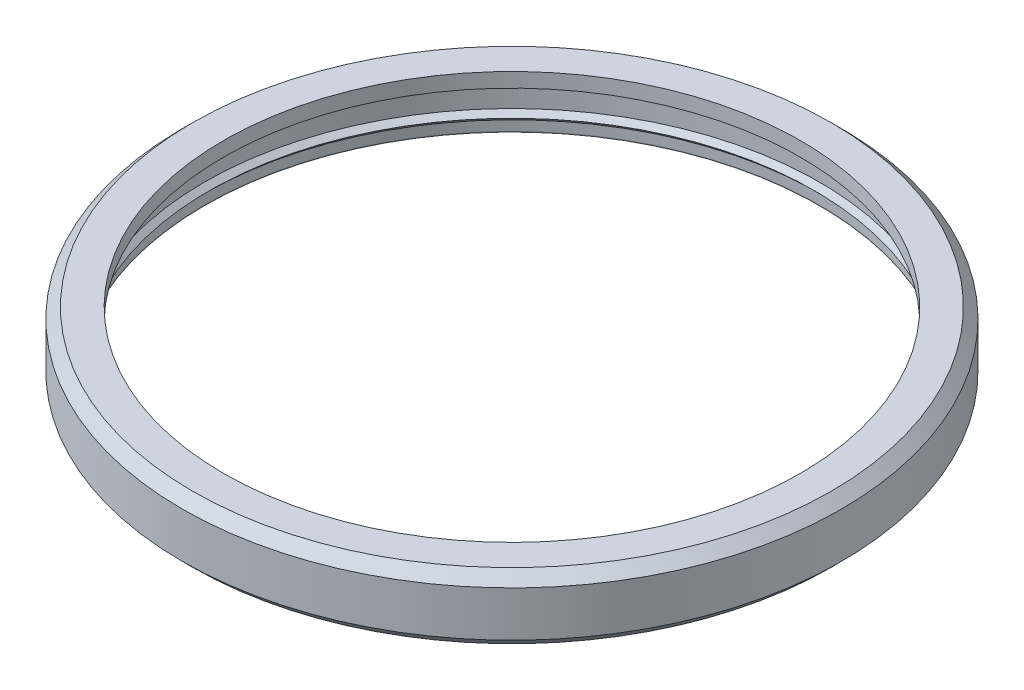
from build123d import *

# Parameters (mm, degrees)
SKETCH_1_R          = 32
EXTRUDE_1_DEPTH     = 2.4
SKETCH_3_R          = 28
CUT_EXTRUDE_1_DEPTH = 10
SKETCH_4_R          = 32
CUT_EXTRUDE_2_DEPTH = 1
CHAMFER_1_SIZE      = 1
CHAMFER_2_SIZE      = 1


with BuildPart() as part:
    # 草图1 → 凸台-拉伸1 (new body)
    with BuildSketch(Plane(origin=(0, 0, 0), x_dir=(1, 0, 0), z_dir=(0, 1, 0))):
        Circle(SKETCH_1_R)
    extrude(amount=EXTRUDE_1_DEPTH)

    # 草图2 → 旋转1 (revolve)
    with BuildSketch(Plane.XY):
        with BuildLine():
            Line((32, 0), (28.897619048, 0))
            ThreePointArc((28.897619048, 0), (29.573809524, -0.30952381), (29.85, -1))
            Line((29.85, -1), (29.85, -3.020710678))
            Line((29.85, -3.020710678), (29.370710678, -3.5))
            Line((29.370710678, -3.5), (29.828219647, -3.957508969))
            Line((29.828219647, -3.957508969), (29.85, -4.95))
            Line((29.85, -4.95), (29.85, -5))
            Line((29.85, -5), (31, -5))
            Line((31, -5), (32, -5))
            Line((32, -5), (32, 0))
        make_face()
    revolve(axis=Axis((0, -25, 0), (0, 1, 0)))

    # 草图3 → 切除-拉伸1 (cut)
    with BuildSketch(Plane(origin=(0, 2.4, 0), x_dir=(1, 0, 0), z_dir=(0, 1, 0))):
        Circle(SKETCH_3_R)
    extrude(amount=-CUT_EXTRUDE_1_DEPTH, mode=Mode.SUBTRACT)

    # 草图4 → 切除-拉伸2 (cut)
    with BuildSketch(Plane(origin=(0, 2.4, 0), x_dir=(1, 0, 0), z_dir=(0, 1, 0))):
        Circle(SKETCH_4_R)
    extrude(amount=-CUT_EXTRUDE_2_DEPTH, mode=Mode.SUBTRACT)

    # 倒角1
    chamfer_1_edges = [part.edges().sort_by_distance(p)[0] for p in [
        (-32, -5, 0),
    ]]
    chamfer(chamfer_1_edges, length=CHAMFER_1_SIZE)

    # 倒角2
    chamfer_2_edges = [part.edges().sort_by_distance(p)[0] for p in [
        (-32, 1.4, 0),
    ]]
    chamfer(chamfer_2_edges, length=CHAMFER_2_SIZE)


solid = part.part
